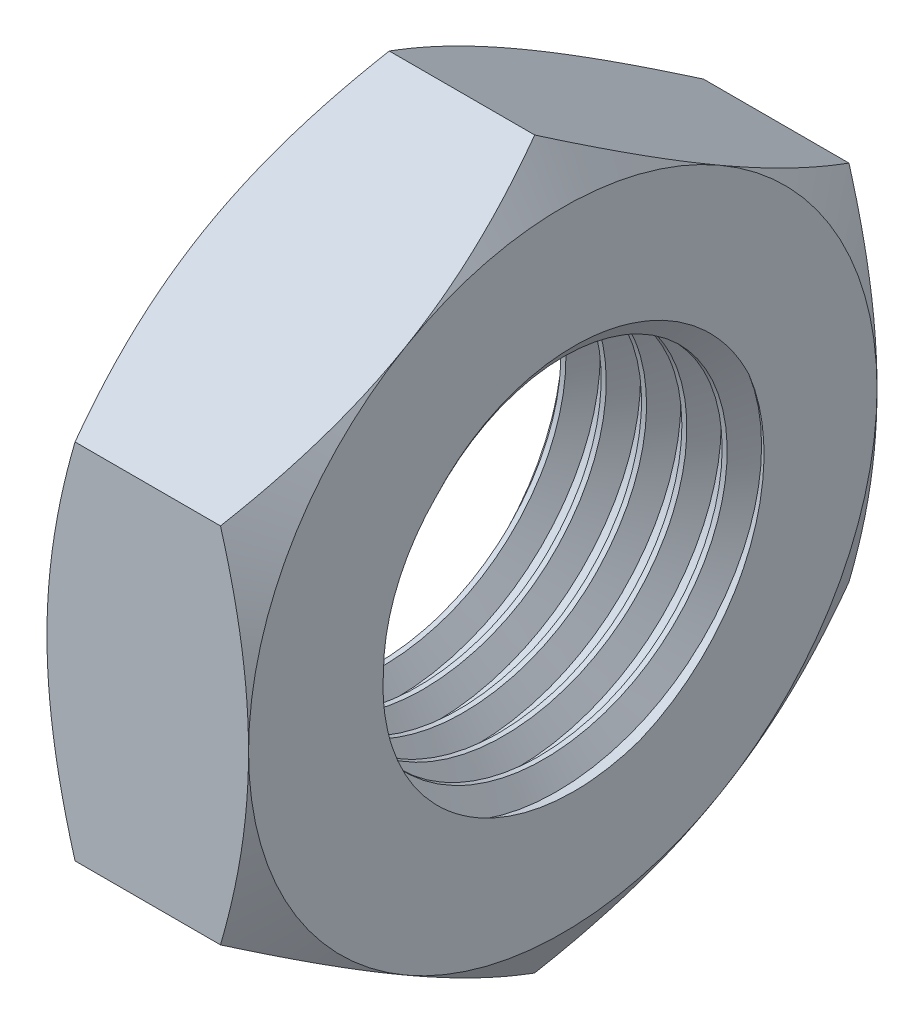
from build123d import *

# Parameters (mm, degrees)
SKETCH2_OUTSIDE_W  = 25.188
SKETCH2_OUTSIDE_H  = 25.188
CUT_EXTRUDE1_DEPTH = 14.674794331
THREAD1_PITCH      = 1


with BuildPart() as part:
    # Sketch1 → Revolve1 (revolve)
    with BuildSketch(Plane.XY, mode=Mode.PRIVATE) as revolve1_sk:
        Polygon((0, 4.45), (0, 7.794228634), (-0.696152423, 9), (-4.303847577, 9), (-5, 7.794228634), (-5, 4.45), align=None)
    revolve(revolve1_sk.sketch.rotate(Axis((0, 0, 0), (-1, 0, 0)), 90), axis=Axis((0, 0, 0), (-1, 0, 0)))

    # Sketch2 outside → Cut-Extrude1 (cut, through all)
    with BuildSketch(Plane(origin=(0, 0, 0), x_dir=(0, 0, -1), z_dir=(1, 0, 0))):
        Rectangle(SKETCH2_OUTSIDE_W, SKETCH2_OUTSIDE_H)
        Polygon((0, 9), (-7.794228634, 4.5), (-7.794228634, -4.5), (0, -9), (7.794228634, -4.5), (7.794228634, 4.5), align=None, mode=Mode.SUBTRACT)
    extrude(amount=-CUT_EXTRUDE1_DEPTH, mode=Mode.SUBTRACT)

    # Thread1: the profile of Thread Profile1 profile screwed along a right-hand helix of 6 turns, 8 arcs to a turn; built about Z, then put on its axis
    thread1_z = Axis((0, 0, 0), (0, 0, 1))
    thread1_corners = [(4.4497, 0, -0.000173205), (4.4497, 0, 0.875173202), (4.991265875, 0, 0.562499999), (4.991265875, 0, 0.312499999)]
    with BuildLine(mode=Mode.PRIVATE) as thread1_profile:
        Line(thread1_corners[0], thread1_corners[1])
        Line(thread1_corners[1], thread1_corners[2])
        Line(thread1_corners[2], thread1_corners[3])
        Line(thread1_corners[3], thread1_corners[0])
    thread1_cap = Face(thread1_profile.wire())
    thread1_turn_angles = [0, 22.5, 45, 67.5, 90, 112.5, 135, 157.5, 180, 202.5, 225, 247.5, 270, 292.5, 315, 337.5, 360]
    thread1_turn_weights = [1, 0.9238795325112867, 1, 0.9238795325112867, 1, 0.9238795325112867, 1, 0.9238795325112867, 1, 0.9238795325112867, 1, 0.9238795325112867, 1, 0.9238795325112867, 1, 0.9238795325112867, 1]
    thread1_turn_rails = [Edge.make_bspline([Vector(p[0], p[1], 0).rotate(thread1_z, thread1_turn_angles[k]) / thread1_turn_weights[k] + Vector(0, 0, p[2] + THREAD1_PITCH * thread1_turn_angles[k] / 360) for k in range(17)], [0, 0, 0, 1, 1, 2, 2, 3, 3, 4, 4, 5, 5, 6, 6, 7, 7, 8, 8, 8], 2, thread1_turn_weights) for p in thread1_corners]
    thread1_turn_sides = [Face.make_surface_from_curves(thread1_turn_rails[p[0]], thread1_turn_rails[p[1]]) for p in [(0, 1), (1, 2), (2, 3), (3, 0)]]
    thread1 = Plane(origin=(1, 0, 0), x_dir=(0, 0, 1), z_dir=(-1, 0, 0)) * Solid(Shell([*[p.moved(Location((0, 0, THREAD1_PITCH * i))) for i in range(6) for p in thread1_turn_sides], thread1_cap, thread1_cap.rotate(thread1_z, 2160).moved(Location((0, 0, THREAD1_PITCH * 2160 / 360)))]))
    add(thread1, mode=Mode.SUBTRACT)


solid = part.part
